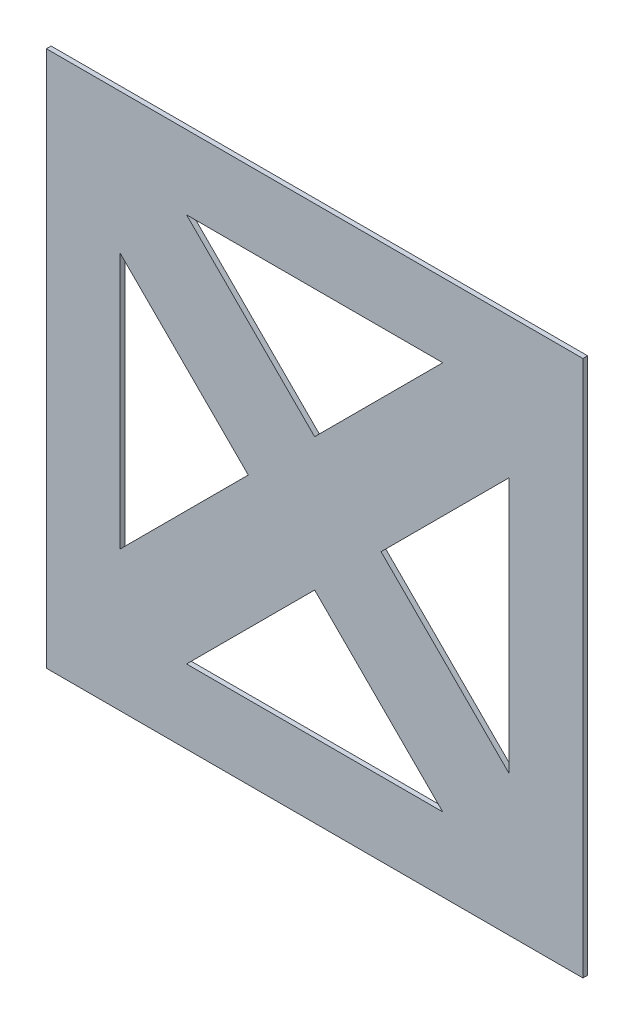
from build123d import *

# Parameters (mm, degrees)
SCHIZZO1_W                   = 800
SCHIZZO1_H                   = 800
ESTRUSIONE_ESTRUSIONE1_DEPTH = 7
TAGLIO_ESTRUSIONE2_DEPTH     = 566.728733582


with BuildPart() as part:
    # Schizzo1 → Estrusione-Estrusione1 (new body)
    with BuildSketch(Plane.XY):
        Rectangle(SCHIZZO1_W, SCHIZZO1_H)
    extrude(amount=ESTRUSIONE_ESTRUSIONE1_DEPTH)

    # Schizzo3 → Taglio-Estrusione2 (cut, through all)
    with BuildSketch(Plane.XY.offset(7)):
        Polygon((-191.005050634, 290), (0, 98.994949366), (191.005050634, 290), align=None)
        Polygon((-98.994949366, 0), (-290, 191.005050634), (-290, -191.005050634), align=None)
        Polygon((290, -191.005050634), (98.994949366, 0), (290, 191.005050634), align=None)
        Polygon((191.005050634, -290), (0, -98.994949366), (-191.005050634, -290), align=None)
    extrude(amount=-TAGLIO_ESTRUSIONE2_DEPTH, mode=Mode.SUBTRACT)


solid = part.part
